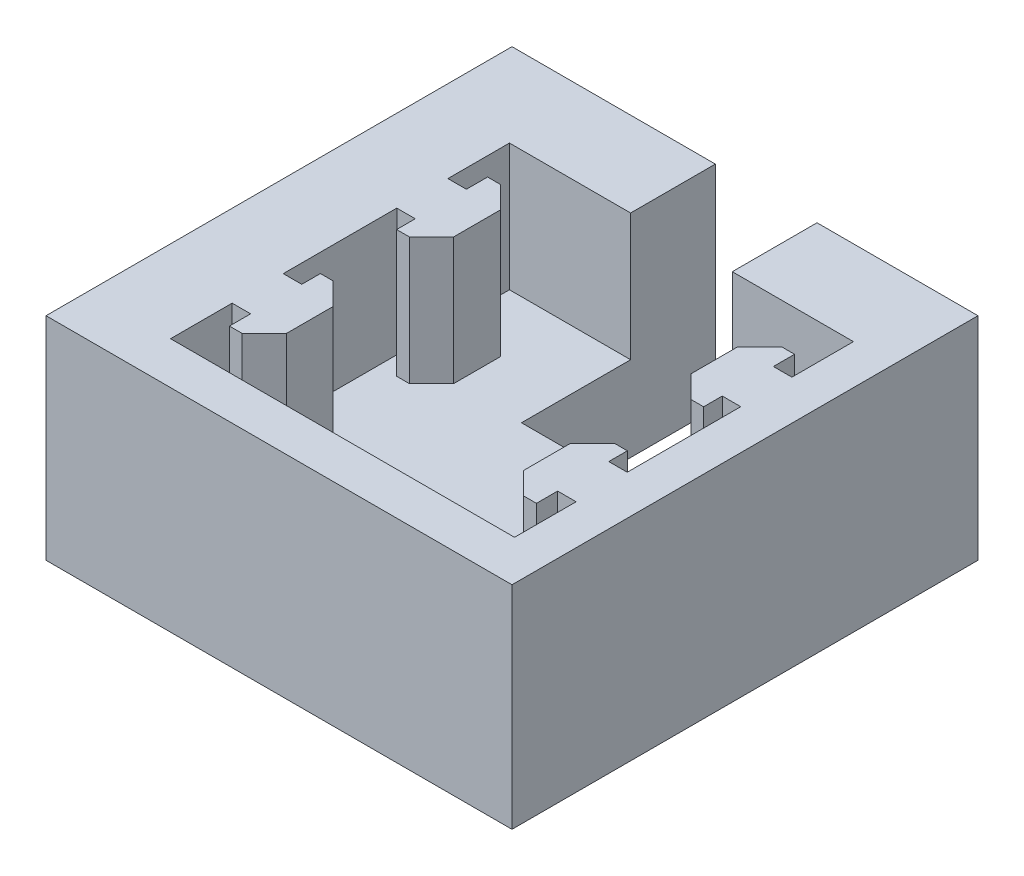
from build123d import *

# Parameters (mm, degrees)
SKETCH1_W           = 55
SKETCH1_H           = 55
BOSS_EXTRUDE1_DEPTH = 10
BOSS_EXTRUDE3_DEPTH = 15
SKETCH3_W           = 55
SKETCH3_H           = 55
SKETCH3_W_2         = 40.6
SKETCH3_H_2         = 40
BOSS_EXTRUDE5_DEPTH = 15
SKETCH7_W           = 12
SKETCH7_H           = 22.88370491
CUT_EXTRUDE3_DEPTH  = 45


with BuildPart() as part:
    # Sketch1 → Boss-Extrude1 (new body)
    with BuildSketch(Plane(origin=(0, 0, 0), x_dir=(1, 0, 0), z_dir=(0, 1, 0))):
        with Locations((-27.5, -27.5)):
            Rectangle(SKETCH1_W, SKETCH1_H)
    extrude(amount=BOSS_EXTRUDE1_DEPTH)

    # Sketch2 → Boss-Extrude3 (add)
    with BuildSketch(Plane(origin=(0, 10, 0), x_dir=(1, 0, 0), z_dir=(0, 1, 0))):
        Polygon((-45.31629509, -17.267409819), (-43.11629509, -17.267409819), (-43.11629509, -14.767409819), (-41.61629509, -14.767409819), (-39, -17.38370491), (-39, -22.88370491), (-41.61629509, -25.5), (-43.11629509, -25.5), (-43.11629509, -23.3), (-45.31629509, -23.3), align=None)
        Polygon((-6.88370491, -23.3), (-4.68370491, -23.3), (-4.68370491, -17.267409819), (-6.88370491, -17.267409819), (-6.88370491, -14.767409819), (-8.38370491, -14.767409819), (-11, -17.38370491), (-11, -22.88370491), (-8.38370491, -25.5), (-6.88370491, -25.5), align=None)
        Polygon((-43.11629509, -36.7), (-45.31629509, -36.7), (-45.31629509, -42.732590181), (-43.11629509, -42.732590181), (-43.11629509, -45.232590181), (-41.61629509, -45.232590181), (-39, -42.61629509), (-39, -37.11629509), (-41.61629509, -34.5), (-43.11629509, -34.5), align=None)
        Polygon((-6.88370491, -34.5), (-6.88370491, -36.7), (-4.68370491, -36.7), (-4.68370491, -42.732590181), (-6.88370491, -42.732590181), (-6.88370491, -45.232590181), (-8.38370491, -45.232590181), (-11, -42.61629509), (-11, -37.11629509), (-8.38370491, -34.5), align=None)
    extrude(amount=BOSS_EXTRUDE3_DEPTH)

    # Sketch3 → Boss-Extrude5 (add)
    with BuildSketch(Plane(origin=(0, 10, 0), x_dir=(1, 0, 0), z_dir=(0, 1, 0))):
        with Locations((-27.5, -27.5)):
            Rectangle(SKETCH3_W, SKETCH3_H)
        with Locations((-25, -30)):
            Rectangle(SKETCH3_W_2, SKETCH3_H_2, mode=Mode.SUBTRACT)
    extrude(amount=BOSS_EXTRUDE5_DEPTH)

    # Sketch7 → Cut-Extrude3 (cut)
    with BuildSketch(Plane(origin=(0, 25, 0), x_dir=(1, 0, 0), z_dir=(0, 1, 0))):
        with Locations((-25, -11.441852455)):
            Rectangle(SKETCH7_W, SKETCH7_H)
    extrude(amount=-CUT_EXTRUDE3_DEPTH, mode=Mode.SUBTRACT)


solid = part.part
